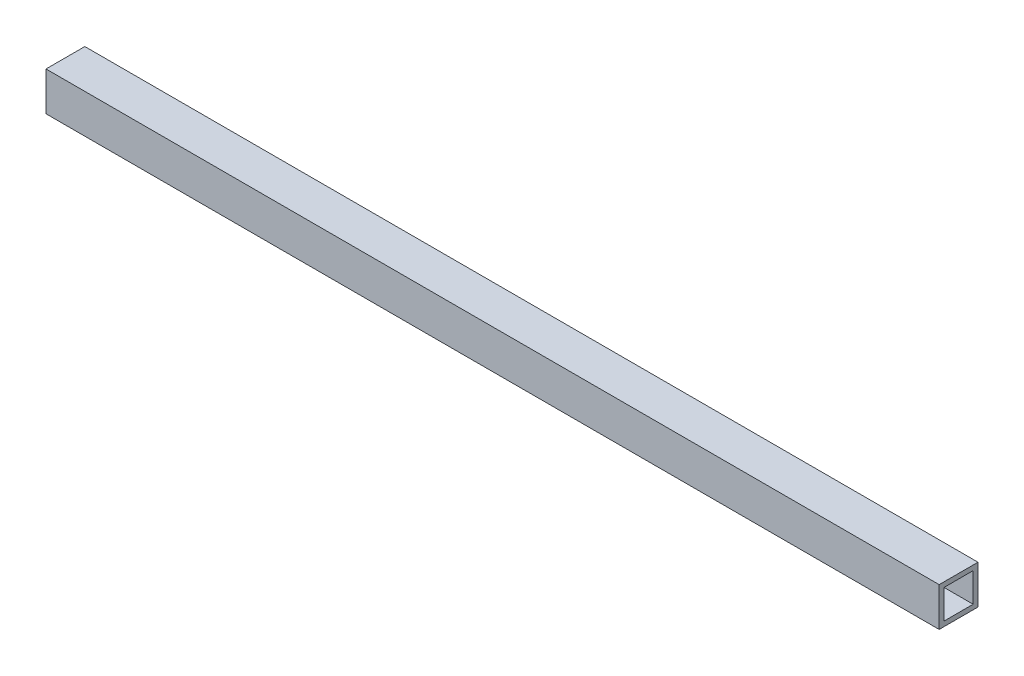
from build123d import *

# Parameters (mm, degrees)
SKETCH1_W           = 25.4
SKETCH1_H           = 25.4
SKETCH1_W_2         = 19.05
SKETCH1_H_2         = 19.05
EXTRUDE_THIN1_DEPTH = 584.2


with BuildPart() as part:
    # Sketch1 → Extrude-Thin1 (new body)
    with BuildSketch(Plane(origin=(0, 0, 0), x_dir=(0, 0, -1), z_dir=(1, 0, 0))):
        with Locations((9.525, 9.525)):
            Rectangle(SKETCH1_W, SKETCH1_H)
        with Locations((9.525, 9.525)):
            Rectangle(SKETCH1_W_2, SKETCH1_H_2, mode=Mode.SUBTRACT)
    extrude(amount=EXTRUDE_THIN1_DEPTH)


solid = part.part
